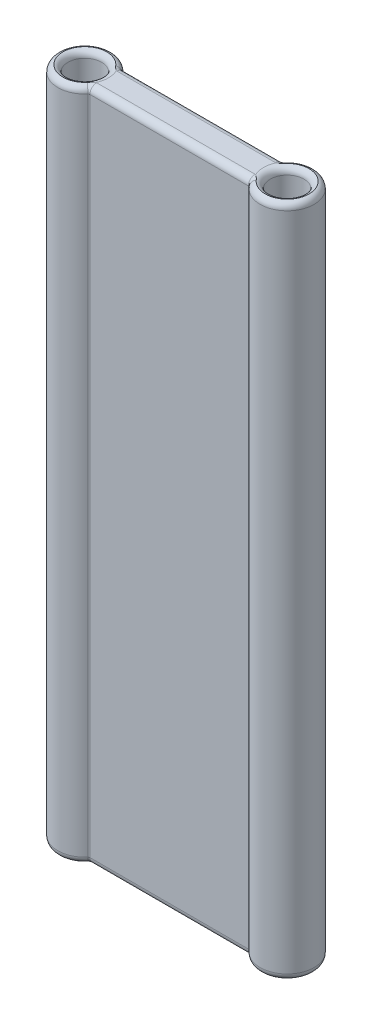
from build123d import *

# Parameters (mm, degrees)
SKETCH1_R           = 6.35000000000001
SKETCH1_R_2         = 6.350000000000002
BOSS_EXTRUDE1_DEPTH = 127
FILLET1_R           = 2.54
SKETCH3_R           = 0.952499999999999
SKETCH3_R_2         = 0.9524999999999999
SKETCH3_R_3         = 0.9525
CUT_EXTRUDE1_DEPTH  = 3.8099999999999996


with BuildPart() as part:
    # Sketch1 → Boss-Extrude1 (new, symmetric)
    with BuildSketch(Plane(origin=(0, 0, 0), x_dir=(1, 0, 0), z_dir=(0, 1, 0))):
        with BuildLine():
            Line((29.845, -6.35), (-29.844999999999995, -6.349999999999999))
            ThreePointArc((-29.844999999999995, -6.349999999999999), (-30.133277104578895, -6.413316273412398), (-30.368487804878054, -6.591609756097566))
            ThreePointArc((-30.368487804878054, -6.591609756097566), (-41.61236644568732, -9.533566066861315), (-48.260000000000026, 2.9661e-12))
            ThreePointArc((-48.260000000000026, 2.9661e-12), (-41.61236644568456, 9.533566066862377), (-30.368487804878054, 6.591609756097566))
            ThreePointArc((-30.368487804878054, 6.591609756097566), (-30.133277104578895, 6.413316273412398), (-29.844999999999995, 6.349999999999999))
            Line((-29.844999999999995, 6.349999999999999), (29.845, 6.35))
            ThreePointArc((29.845, 6.35), (30.133277104578898, 6.4133162734123985), (30.368487804878054, 6.591609756097566))
            ThreePointArc((30.368487804878054, 6.591609756097566), (41.612366445686106, 9.533566066861773), (48.26, -3.4895e-13))
            ThreePointArc((48.26, -3.4895e-13), (41.61236644568578, -9.533566066861898), (30.368487804878054, -6.591609756097566))
            ThreePointArc((30.368487804878054, -6.591609756097566), (30.133277104578895, -6.413316273412399), (29.845, -6.35))
        make_face()
        with Locations(Location((38.1, 0, 0), (0, 0, 270))):
            Circle(SKETCH1_R, mode=Mode.SUBTRACT)
        with Locations(Location((-38.09999999999999, -9.33e-15, 0), (0, 0, 90))):
            Circle(SKETCH1_R_2, mode=Mode.SUBTRACT)
    extrude(amount=BOSS_EXTRUDE1_DEPTH, both=True)

    # Fillet1
    # the kernel refuses this fillet: 2.54 mm, written as the material it takes off along each edge
    with BuildSketch(Plane(origin=(38.1, -127, 5.33e-15), x_dir=(-0.7609756097560968, 0, -0.6487804878048788), z_dir=(-0.6487804878048788, 0, 0.7609756097560968))) as fillet1_piece_1:
        with BuildLine():
            CenterArc((10.160000000000002 - FILLET1_R, -FILLET1_R), FILLET1_R, 0, 90)
            Line((10.160000000000002 - FILLET1_R, 0), (10.160000000000002, 0))
            Line((10.160000000000002, 0), (10.160000000000002, -FILLET1_R))
        make_face()
    revolve(axis=Axis((38.1, -127, 5.33e-15), (0, -1, 0)), revolution_arc=139.5502811376657, mode=Mode.SUBTRACT)
    with BuildSketch(Plane(origin=(29.84499999999999, -127, 7.037916666666687), x_dir=(0.7609756097560946, 0, -0.6487804878048815), z_dir=(0.6487804878048815, 0, 0.7609756097560946))) as fillet1_piece_2:
        with BuildLine():
            CenterArc((0.6879166666666876 + FILLET1_R, FILLET1_R), FILLET1_R, 180, 90)
            Line((0.6879166666666876 + FILLET1_R, 0), (0.6879166666666876, 0))
            Line((0.6879166666666876, 0), (0.6879166666666888, FILLET1_R))
        make_face()
    revolve(axis=Axis((29.84499999999999, -127, 7.037916666666687), (0, 1, 0)), revolution_arc=49.55028113766299, mode=Mode.SUBTRACT)
    with BuildSketch(Plane(origin=(29.845, -127, 6.35), x_dir=(1e-17, 0, -1), z_dir=(-1, 0, -1e-17)), Plane(origin=(-29.844999999999995, -127, -6.349999999999999), x_dir=(1e-17, 0, 1), z_dir=(1, 0, -1e-17))) as fillet1_piece_3:
        with BuildLine():
            CenterArc((FILLET1_R, -FILLET1_R), FILLET1_R, 90, 90)
            Line((0, -FILLET1_R), (0, 0))
            Line((0, 0), (FILLET1_R, 0))
        make_face()
    extrude(amount=59.69, mode=Mode.SUBTRACT)
    with BuildSketch(Plane(origin=(-29.845, -127, 7.037916666666673), x_dir=(5.16e-15, 0, -1), z_dir=(1, 0, 5.16e-15))) as fillet1_piece_4:
        with BuildLine():
            CenterArc((0.6879166666666734 + FILLET1_R, FILLET1_R), FILLET1_R, 180, 90)
            Line((0.6879166666666734, FILLET1_R), (0.6879166666666734, 0))
            Line((0.6879166666666734, 0), (0.6879166666666734 + FILLET1_R, 0))
        make_face()
    revolve(axis=Axis((-29.845, -127, 7.037916666666673), (0, 1, 0)), revolution_arc=49.550281137664385, mode=Mode.SUBTRACT)
    with BuildSketch(Plane(origin=(-38.099999999999994, -127, -4.574e-14), x_dir=(0.7609756097560946, 0, 0.6487804878048816), z_dir=(0.6487804878048816, 0, -0.7609756097560946))) as fillet1_piece_5:
        with BuildLine():
            CenterArc((10.16000000000003 - FILLET1_R, -FILLET1_R), FILLET1_R, 0, 90)
            Line((10.16000000000003, -FILLET1_R), (10.16000000000003, 0))
            Line((10.16000000000003, 0), (10.16000000000003 - FILLET1_R, 0))
        make_face()
    revolve(axis=Axis((-38.099999999999994, -127, -4.574e-14), (0, -1, 0)), revolution_arc=139.55028113768003, mode=Mode.SUBTRACT)
    with BuildSketch(Plane(origin=(-29.845, -127, -7.037916666666672), x_dir=(-0.7609756097561005, 0, 0.6487804878048747), z_dir=(-0.6487804878048747, 0, -0.7609756097561005))) as fillet1_piece_6:
        with BuildLine():
            CenterArc((0.6879166666666725 + FILLET1_R, FILLET1_R), FILLET1_R, 180, 90)
            Line((0.687916666666671, FILLET1_R), (0.6879166666666725, 0))
            Line((0.6879166666666725, 0), (0.6879166666666725 + FILLET1_R, 0))
        make_face()
    revolve(axis=Axis((-29.845, -127, -7.037916666666672), (0, 1, 0)), revolution_arc=49.55028113766444, mode=Mode.SUBTRACT)
    with BuildSketch(Plane(origin=(-29.844999999999995, 127, -6.349999999999999), x_dir=(1e-17, 0, 1), z_dir=(1, 0, -1e-17)), Plane(origin=(29.845, 127, 6.35), x_dir=(1e-17, 0, -1), z_dir=(-1, 0, -1e-17))) as fillet1_piece_7:
        with BuildLine():
            CenterArc((FILLET1_R, FILLET1_R), FILLET1_R, 180, 90)
            Line((0, FILLET1_R), (0, 0))
            Line((0, 0), (FILLET1_R, 0))
        make_face()
    extrude(amount=59.69, mode=Mode.SUBTRACT)
    with BuildSketch(Plane(origin=(29.845000000000002, -127, -7.037916666666662), x_dir=(-5.16e-15, 0, 1), z_dir=(-1, 0, -5.16e-15))) as fillet1_piece_8:
        with BuildLine():
            CenterArc((0.6879166666666627 + FILLET1_R, FILLET1_R), FILLET1_R, 180, 90)
            Line((0.6879166666666627, FILLET1_R), (0.6879166666666627, 0))
            Line((0.6879166666666627, 0), (0.6879166666666627 + FILLET1_R, 0))
        make_face()
    revolve(axis=Axis((29.845000000000002, -127, -7.037916666666662), (0, 1, 0)), revolution_arc=49.55028113766487, mode=Mode.SUBTRACT)
    with BuildSketch(Plane(origin=(-29.845, 127, -7.037916666666672), x_dir=(-0.7609756097561005, 0, 0.6487804878048747), z_dir=(-0.6487804878048747, 0, -0.7609756097561005))) as fillet1_piece_9:
        with BuildLine():
            CenterArc((0.6879166666666725 + FILLET1_R, -FILLET1_R), FILLET1_R, 90, 90)
            Line((0.687916666666671, -FILLET1_R), (0.6879166666666725, 0))
            Line((0.6879166666666725, 0), (0.6879166666666725 + FILLET1_R, 0))
        make_face()
    revolve(axis=Axis((-29.845, 127, -7.037916666666672), (0, 1, 0)), revolution_arc=49.55028113766444, mode=Mode.SUBTRACT)
    with BuildSketch(Plane(origin=(-38.099999999999994, 127, -4.574e-14), x_dir=(0.7609756097560946, 0, 0.6487804878048816), z_dir=(0.6487804878048816, 0, -0.7609756097560946))) as fillet1_piece_10:
        with BuildLine():
            CenterArc((10.16000000000003 - FILLET1_R, FILLET1_R), FILLET1_R, 270, 90)
            Line((10.16000000000003, FILLET1_R), (10.16000000000003, 0))
            Line((10.16000000000003, 0), (10.16000000000003 - FILLET1_R, 0))
        make_face()
    revolve(axis=Axis((-38.099999999999994, 127, -4.574e-14), (0, -1, 0)), revolution_arc=139.55028113768003, mode=Mode.SUBTRACT)
    with BuildSketch(Plane(origin=(-38.09999999999999, -127, 9.33e-15), x_dir=(0, 0, -1), z_dir=(1, 0, 0))) as fillet1_piece_11:
        with BuildLine():
            CenterArc((6.350000000000002 + FILLET1_R, FILLET1_R), FILLET1_R, 180, 90)
            Line((6.350000000000001, FILLET1_R), (6.350000000000002, 0))
            Line((6.350000000000002, 0), (6.350000000000002 + FILLET1_R, 0))
        make_face()
    revolve(axis=Axis((-38.09999999999999, -127, 9.33e-15), (0, 1, 0)), mode=Mode.SUBTRACT)
    with BuildSketch(Plane(origin=(-38.09999999999999, 127, 9.33e-15), x_dir=(0, 0, -1), z_dir=(1, 0, 0))) as fillet1_piece_12:
        with BuildLine():
            CenterArc((6.350000000000002 + FILLET1_R, -FILLET1_R), FILLET1_R, 90, 90)
            Line((6.350000000000001, -FILLET1_R), (6.350000000000002, 0))
            Line((6.350000000000002, 0), (6.350000000000002 + FILLET1_R, 0))
        make_face()
    revolve(axis=Axis((-38.09999999999999, 127, 9.33e-15), (0, 1, 0)), mode=Mode.SUBTRACT)
    with BuildSketch(Plane(origin=(-29.845, 127, 7.037916666666673), x_dir=(5.16e-15, 0, -1), z_dir=(1, 0, 5.16e-15))) as fillet1_piece_13:
        with BuildLine():
            CenterArc((0.6879166666666734 + FILLET1_R, -FILLET1_R), FILLET1_R, 90, 90)
            Line((0.6879166666666734, -FILLET1_R), (0.6879166666666734, 0))
            Line((0.6879166666666734, 0), (0.6879166666666734 + FILLET1_R, 0))
        make_face()
    revolve(axis=Axis((-29.845, 127, 7.037916666666673), (0, 1, 0)), revolution_arc=49.550281137664385, mode=Mode.SUBTRACT)
    with BuildSketch(Plane(origin=(38.1, -127, 0), x_dir=(0, 0, 1), z_dir=(-1, 0, 0))) as fillet1_piece_14:
        with BuildLine():
            CenterArc((6.35000000000001 + FILLET1_R, FILLET1_R), FILLET1_R, 180, 90)
            Line((6.350000000000009, FILLET1_R), (6.35000000000001, 0))
            Line((6.35000000000001, 0), (6.35000000000001 + FILLET1_R, 0))
        make_face()
    revolve(axis=Axis((38.1, -127, 0), (0, 1, 0)), mode=Mode.SUBTRACT)
    with BuildSketch(Plane(origin=(38.1, 127, 0), x_dir=(0, 0, 1), z_dir=(-1, 0, 0))) as fillet1_piece_15:
        with BuildLine():
            CenterArc((6.35000000000001 + FILLET1_R, -FILLET1_R), FILLET1_R, 90, 90)
            Line((6.350000000000009, -FILLET1_R), (6.35000000000001, 0))
            Line((6.35000000000001, 0), (6.35000000000001 + FILLET1_R, 0))
        make_face()
    revolve(axis=Axis((38.1, 127, 0), (0, 1, 0)), mode=Mode.SUBTRACT)
    with BuildSketch(Plane(origin=(29.84499999999999, 127, 7.037916666666687), x_dir=(0.7609756097560946, 0, -0.6487804878048815), z_dir=(0.6487804878048815, 0, 0.7609756097560946))) as fillet1_piece_16:
        with BuildLine():
            CenterArc((0.6879166666666876 + FILLET1_R, -FILLET1_R), FILLET1_R, 90.00000000000003, 90)
            Line((0.6879166666666876 + FILLET1_R, 0), (0.6879166666666876, 0))
            Line((0.6879166666666876, 0), (0.6879166666666888, -FILLET1_R))
        make_face()
    revolve(axis=Axis((29.84499999999999, 127, 7.037916666666687), (0, 1, 0)), revolution_arc=49.55028113766299, mode=Mode.SUBTRACT)
    with BuildSketch(Plane(origin=(38.1, 127, 5.33e-15), x_dir=(-0.7609756097560968, 0, -0.6487804878048788), z_dir=(-0.6487804878048788, 0, 0.7609756097560968))) as fillet1_piece_17:
        with BuildLine():
            CenterArc((10.160000000000002 - FILLET1_R, FILLET1_R), FILLET1_R, 270, 90)
            Line((10.160000000000002 - FILLET1_R, 0), (10.160000000000002, 0))
            Line((10.160000000000002, 0), (10.160000000000002, FILLET1_R))
        make_face()
    revolve(axis=Axis((38.1, 127, 5.33e-15), (0, -1, 0)), revolution_arc=139.5502811376657, mode=Mode.SUBTRACT)
    with BuildSketch(Plane(origin=(29.845000000000002, 127, -7.037916666666662), x_dir=(-5.16e-15, 0, 1), z_dir=(-1, 0, -5.16e-15))) as fillet1_piece_18:
        with BuildLine():
            CenterArc((0.6879166666666627 + FILLET1_R, -FILLET1_R), FILLET1_R, 90, 90)
            Line((0.6879166666666627, -FILLET1_R), (0.6879166666666627, 0))
            Line((0.6879166666666627, 0), (0.6879166666666627 + FILLET1_R, 0))
        make_face()
    revolve(axis=Axis((29.845000000000002, 127, -7.037916666666662), (0, 1, 0)), revolution_arc=49.55028113766487, mode=Mode.SUBTRACT)
    with BuildSketch(Plane(origin=(38.1, 127, 6.22e-15), x_dir=(1, 0, 3.373e-14), z_dir=(3.373e-14, 0, -1))) as fillet1_piece_19:
        with BuildLine():
            CenterArc((10.15999999999999 - FILLET1_R, FILLET1_R), FILLET1_R, 269.99999999999983, 90.00000000000017)
            Line((10.15999999999999 - FILLET1_R, 0), (10.15999999999999, 0))
            Line((10.15999999999999, 0), (10.159999999999997, FILLET1_R))
        make_face()
    revolve(axis=Axis((38.1, 127, 6.22e-15), (0, -1, 0)), revolution_arc=139.5502811376619, mode=Mode.SUBTRACT)
    with BuildSketch(Plane(origin=(-38.10000000000002, 127, -1.954e-14), x_dir=(-1, 0, -2.9002e-13), z_dir=(-2.9002e-13, 0, 1))) as fillet1_piece_20:
        with BuildLine():
            CenterArc((10.159999999999997 - FILLET1_R, FILLET1_R), FILLET1_R, 270, 90)
            Line((10.159999999999997, FILLET1_R), (10.159999999999997, 0))
            Line((10.159999999999997, 0), (10.159999999999997 - FILLET1_R, 0))
        make_face()
    revolve(axis=Axis((-38.10000000000002, 127, -1.954e-14), (0, -1, 0)), revolution_arc=139.55028113764735, mode=Mode.SUBTRACT)
    with BuildSketch(Plane(origin=(-38.10000000000002, -127, -1.954e-14), x_dir=(-1, 0, -2.9002e-13), z_dir=(-2.9002e-13, 0, 1))) as fillet1_piece_21:
        with BuildLine():
            CenterArc((10.159999999999997 - FILLET1_R, -FILLET1_R), FILLET1_R, 0, 90)
            Line((10.159999999999997, -FILLET1_R), (10.159999999999997, 0))
            Line((10.159999999999997, 0), (10.159999999999997 - FILLET1_R, 0))
        make_face()
    revolve(axis=Axis((-38.10000000000002, -127, -1.954e-14), (0, -1, 0)), revolution_arc=139.55028113764735, mode=Mode.SUBTRACT)
    with BuildSketch(Plane(origin=(38.1, -127, 6.22e-15), x_dir=(1, 0, 3.373e-14), z_dir=(3.373e-14, 0, -1))) as fillet1_piece_22:
        with BuildLine():
            CenterArc((10.15999999999999 - FILLET1_R, -FILLET1_R), FILLET1_R, 0, 90.00000000000017)
            Line((10.15999999999999 - FILLET1_R, 0), (10.15999999999999, 0))
            Line((10.15999999999999, 0), (10.159999999999997, -FILLET1_R))
        make_face()
    revolve(axis=Axis((38.1, -127, 6.22e-15), (0, -1, 0)), revolution_arc=139.5502811376619, mode=Mode.SUBTRACT)

    # Sketch3 → Cut-Extrude1 (cut)
    with BuildSketch(Plane(origin=(-9e-17, 0, -6.35), x_dir=(-1, 0, 1e-17), z_dir=(-1e-17, 0, -1))):
        with Locations((-26.987499999999834, -96.19009179520316)):
            Circle(SKETCH3_R)
        with Locations((-26.987500000000278, -2.2100917952029753)):
            Circle(SKETCH3_R_2)
        with Locations((26.987499999999834, -2.2100917952029753)):
            Circle(SKETCH3_R_2)
        with Locations((26.987500000000164, -96.19009179520299)):
            Circle(SKETCH3_R)
        with Locations((-24.76499999999981, 3.6638663454109723)):
            Circle(SKETCH3_R_3)
        with Locations((-24.76500000000033, 102.97786634541117)):
            Circle(SKETCH3_R)
        with Locations((24.76499999999983, 102.97786634541117)):
            Circle(SKETCH3_R)
        with Locations((24.765000000000196, 3.6638663454111873)):
            Circle(SKETCH3_R_3)
    extrude(amount=-CUT_EXTRUDE1_DEPTH, mode=Mode.SUBTRACT)


solid = part.part
